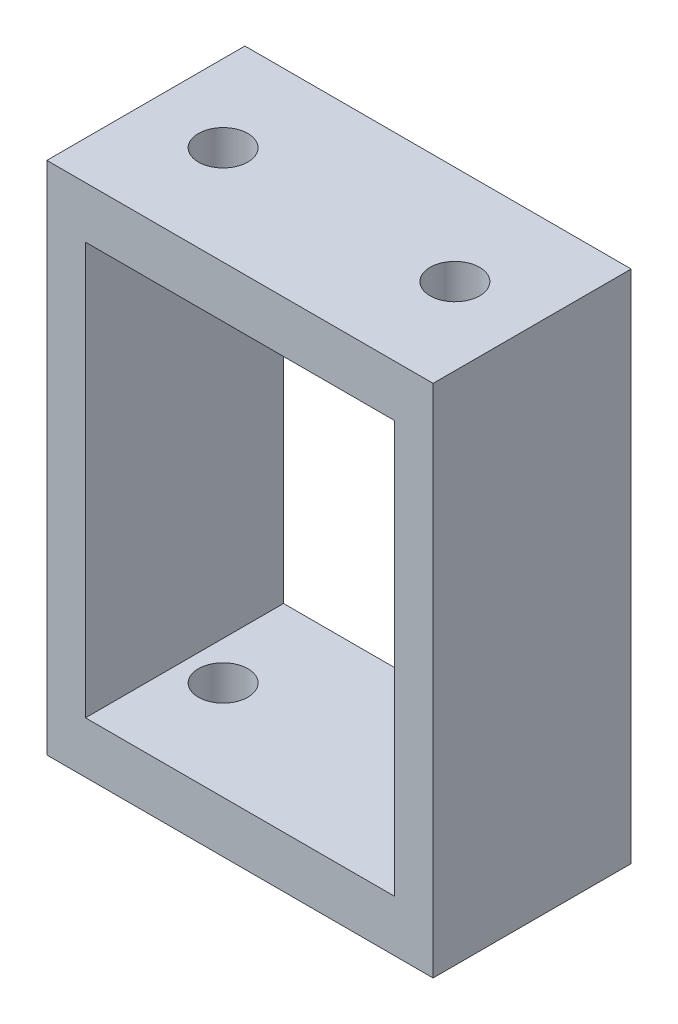
from build123d import *

# Parameters (mm, degrees)
SKETCH1_W           = 19.5
SKETCH1_H           = 26
BOSS_EXTRUDE1_DEPTH = 10
CUT_EXTRUDE1_REACH  = 21.08
SKETCH2_W           = 15.6
SKETCH2_H           = 20.8
CUT_EXTRUDE2_REACH  = 31.514
SKETCH3_R           = 1.25
CUT_EXTRUDE3_REACH  = 31.514
SKETCH5_R           = 1.25


with BuildPart() as part:
    # Sketch1 → Boss-Extrude1 (new body)
    with BuildSketch(Plane.XY):
        Rectangle(SKETCH1_W, SKETCH1_H)
    extrude(amount=BOSS_EXTRUDE1_DEPTH)

    # Sketch2 → Cut-Extrude1 (cut, up to next)
    with BuildSketch(Plane.XY.offset(10), mode=Mode.PRIVATE) as cut_extrude1_sk1:
        Rectangle(SKETCH2_W, SKETCH2_H)
    cut_extrude1_tool1 = extrude(cut_extrude1_sk1.sketch, amount=-CUT_EXTRUDE1_REACH, mode=Mode.PRIVATE) & part.part
    add(cut_extrude1_tool1.solids().sort_by_distance((0, 0, 10))[0], mode=Mode.SUBTRACT)

    # Sketch3 → Cut-Extrude2 (cut, up to next)
    with BuildSketch(Plane.XZ.offset(13), mode=Mode.PRIVATE) as cut_extrude2_sk1:
        with Locations((-5.85, 5)):
            Circle(SKETCH3_R)
    cut_extrude2_tool1 = extrude(cut_extrude2_sk1.sketch, amount=-CUT_EXTRUDE2_REACH, mode=Mode.PRIVATE) & part.part
    # Sketch3 → Cut-Extrude2 (cut, up to next)
    with BuildSketch(Plane.XZ.offset(13), mode=Mode.PRIVATE) as cut_extrude2_sk2:
        with Locations((5.85, 5)):
            Circle(SKETCH3_R)
    cut_extrude2_tool2 = extrude(cut_extrude2_sk2.sketch, amount=-CUT_EXTRUDE2_REACH, mode=Mode.PRIVATE) & part.part
    add(cut_extrude2_tool1.solids().sort_by_distance((-5.85, -13, 5))[0], mode=Mode.SUBTRACT)
    add(cut_extrude2_tool2.solids().sort_by_distance((5.85, -13, 5))[0], mode=Mode.SUBTRACT)

    # Sketch5 → Cut-Extrude3 (cut, up to next)
    with BuildSketch(Plane(origin=(0, 13, 0), x_dir=(1, 0, 0), z_dir=(0, 1, 0)), mode=Mode.PRIVATE) as cut_extrude3_sk1:
        with Locations((-5.85, -5)):
            Circle(SKETCH5_R)
    cut_extrude3_tool1 = extrude(cut_extrude3_sk1.sketch, amount=-CUT_EXTRUDE3_REACH, mode=Mode.PRIVATE) & part.part
    # Sketch5 → Cut-Extrude3 (cut, up to next)
    with BuildSketch(Plane(origin=(0, 13, 0), x_dir=(1, 0, 0), z_dir=(0, 1, 0)), mode=Mode.PRIVATE) as cut_extrude3_sk2:
        with Locations((5.85, -5)):
            Circle(SKETCH5_R)
    cut_extrude3_tool2 = extrude(cut_extrude3_sk2.sketch, amount=-CUT_EXTRUDE3_REACH, mode=Mode.PRIVATE) & part.part
    add(cut_extrude3_tool1.solids().sort_by_distance((-5.85, 13, 5))[0], mode=Mode.SUBTRACT)
    add(cut_extrude3_tool2.solids().sort_by_distance((5.85, 13, 5))[0], mode=Mode.SUBTRACT)


solid = part.part
